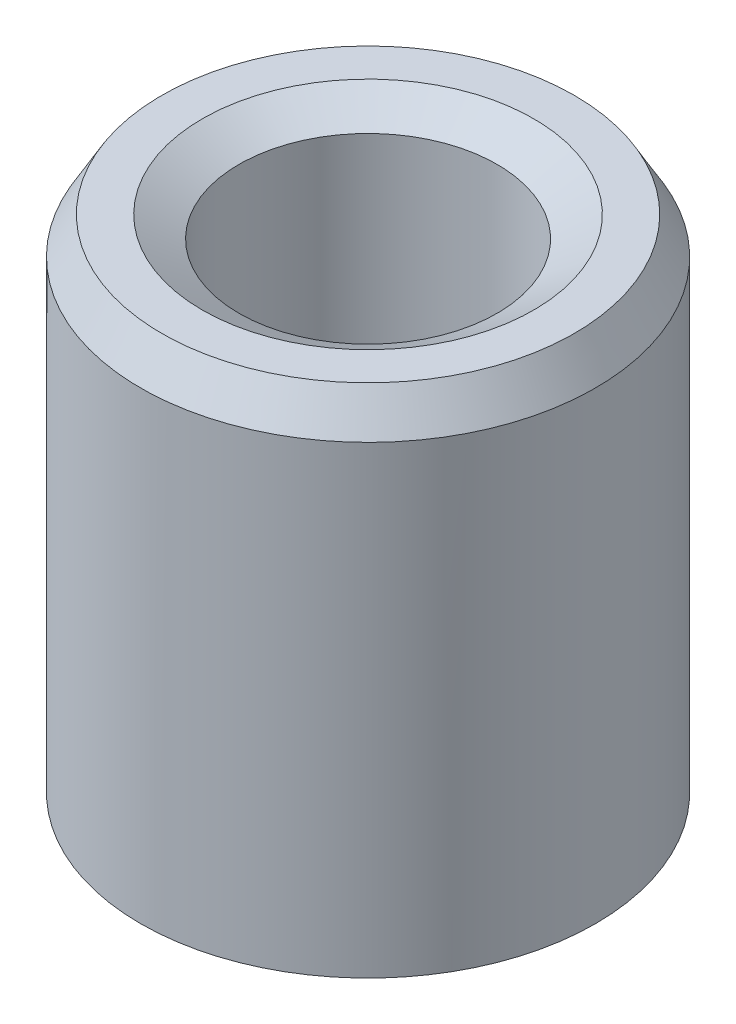
from build123d import *
from OCP.BRepFilletAPI import BRepFilletAPI_MakeChamfer

# Parameters (mm, degrees)
SKETCH1_R           = 17.5
BOSS_EXTRUDE1_DEPTH = 40.1490924
SKETCH2_R           = 9.931711183
CUT_EXTRUDE1_DEPTH  = 48.164071289
CHAMFER1_SIZE       = 2.819824628
CHAMFER1_SIZE2      = 1.628026508


with BuildPart() as part:
    # Sketch1 → Boss-Extrude1 (new body)
    with BuildSketch(Plane(origin=(0, 0, 0), x_dir=(1, 0, 0), z_dir=(0, 1, 0))):
        Circle(SKETCH1_R)
    extrude(amount=BOSS_EXTRUDE1_DEPTH)

    # Sketch2 → Cut-Extrude1 (cut, through all)
    with BuildSketch(Plane(origin=(0, 0, 0), x_dir=(1, 0, 0), z_dir=(0, 1, 0))):
        Circle(SKETCH2_R)
    extrude(amount=CUT_EXTRUDE1_DEPTH, mode=Mode.SUBTRACT)

    # Chamfer1: one chamfer whose edges measure the first distance from different faces: ONE call of the kernel's chamfer builder (chamfer() names one face for all edges)
    chamfer1_edges_1 = [part.edges().sort_by_distance(p)[0] for p in [
        (-9.931711183, 40.1490924, 0),
    ]]
    chamfer1_side_1 = [part.faces().sort_by_distance(p)[0] for p in [
        (-17.005025253, 40.1490924, 0),
    ]]
    chamfer1_edges_2 = [part.edges().sort_by_distance(p)[0] for p in [
        (-9.931711183, 0, 0),
    ]]
    chamfer1_side_2 = [part.faces().sort_by_distance(p)[0] for p in [
        (-9.931711183, 20.0745462, 0),
    ]]
    chamfer1_edges_3 = [part.edges().sort_by_distance(p)[0] for p in [
        (-17.5, 0, 0),
    ]]
    chamfer1_side_3 = [part.faces().sort_by_distance(p)[0] for p in [
        (-17.005025253, 0, 0),
    ]]
    chamfer1_edges_4 = [part.edges().sort_by_distance(p)[0] for p in [
        (-17.5, 40.1490924, 0),
    ]]
    chamfer1_side_4 = [part.faces().sort_by_distance(p)[0] for p in [
        (-17.5, 20.0745462, 0),
    ]]
    chamfer1 = BRepFilletAPI_MakeChamfer(part.part.solid().wrapped)
    for e in chamfer1_edges_1:
        chamfer1.Add(CHAMFER1_SIZE, CHAMFER1_SIZE2, e.wrapped, chamfer1_side_1[0].wrapped)  # the first distance lies on this face
    for e in chamfer1_edges_2:
        chamfer1.Add(CHAMFER1_SIZE, CHAMFER1_SIZE2, e.wrapped, chamfer1_side_2[0].wrapped)  # the first distance lies on this face
    for e in chamfer1_edges_3:
        chamfer1.Add(CHAMFER1_SIZE, CHAMFER1_SIZE2, e.wrapped, chamfer1_side_3[0].wrapped)  # the first distance lies on this face
    for e in chamfer1_edges_4:
        chamfer1.Add(CHAMFER1_SIZE, CHAMFER1_SIZE2, e.wrapped, chamfer1_side_4[0].wrapped)  # the first distance lies on this face
    add(Compound.cast(chamfer1.Shape()), mode=Mode.REPLACE)


solid = part.part
